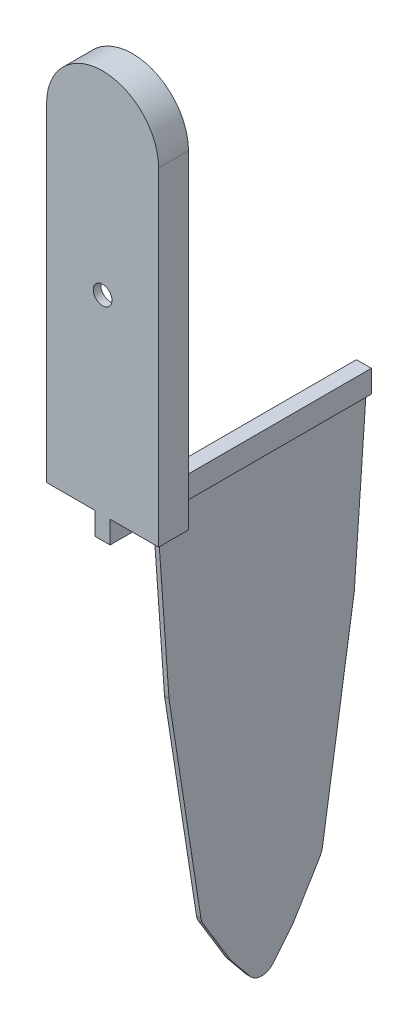
from build123d import *

# Parameters (mm, degrees)
EXTRUDE_1_DEPTH      = 4
CUT_EXTRUDE_1_DEPTH  = 3
SKETCH_5_R           = 1.25
CUT_EXTRUDE_2_DEPTH  = 12.4
EXTRUDE_2_DEPTH      = 1
EXTRUDE_2_DEPTH_BACK = 1
SKETCH_6_W           = 35
SKETCH_6_H           = 3
EXTRUDE_4_DEPTH      = 0.3


with BuildPart() as part:
    # 草圖1 → 填料-伸長1 (new body)
    with BuildSketch(Plane.XY):
        with BuildLine():
            Line((7.5, 8), (7.5, 52))
            ThreePointArc((7.5, 52), (0, 59.5), (-7.5, 52))
            Line((-7.5, 52), (-7.5, 8))
            Line((-7.5, 8), (7.5, 8))
        make_face()
    extrude(amount=EXTRUDE_1_DEPTH)

    # 草圖3 → 除料-伸長1 (cut)
    with BuildSketch(Plane.XY):
        with BuildLine():
            Line((4.745157216, 31.924092961), (5, 33.5))
            Line((5, 33.5), (4.738581133, 35.095571636))
            Line((4.738581133, 35.095571636), (2.296635758, 50))
            ThreePointArc((2.296635758, 50), (0, 52.296635758), (-2.296635758, 50))
            Line((-2.296635758, 50), (-4.738581133, 35.095571636))
            Line((-4.738581133, 35.095571636), (-5, 33.5))
            Line((-5, 33.5), (-4.739562708, 31.907346446))
            Line((-4.739562708, 31.907346446), (-2.301851795, 17))
            ThreePointArc((-2.301851795, 17), (-0.184323371, 14.705540024), (2.272331993, 16.632537074))
            Line((2.272331993, 16.632537074), (4.745157216, 31.924092961))
        make_face()
    extrude(amount=CUT_EXTRUDE_1_DEPTH, mode=Mode.SUBTRACT)

    # 草圖5 → 除料-伸長2 (cut)
    with BuildSketch(Plane.XY):
        with Locations((0, 33.5)):
            Circle(SKETCH_5_R)
    extrude(amount=CUT_EXTRUDE_2_DEPTH, mode=Mode.SUBTRACT)

    # 草圖6 → 填料-伸長2 (add, two sides: drawn at the far end of the back side and taken through both)
    with BuildSketch(Plane(origin=(0, 0, 0), x_dir=(0, 0, -1), z_dir=(1, 0, 0)).offset(-EXTRUDE_2_DEPTH_BACK)):
        with Locations((13.5, 6.5)):
            Rectangle(SKETCH_6_W, SKETCH_6_H)
    extrude(amount=EXTRUDE_2_DEPTH + EXTRUDE_2_DEPTH_BACK)

    # 草圖8 → 填料-伸長4 (add, symmetric)
    with BuildSketch(Plane(origin=(0, 0, 0), x_dir=(0, 0, -1), z_dir=(1, 0, 0))):
        with BuildLine():
            Line((31, 5), (29.412884636, -17.392266292))
            ThreePointArc((29.412884636, -17.392266292), (29.405303504, -17.474886329), (29.394302258, -17.557120851))
            Line((29.394302258, -17.557120851), (25.126031789, -45.102305987))
            Line((25.126031789, -45.102305987), (24.858838061, -45.834592809))
            Line((24.858838061, -45.834592809), (21.249328626, -51.775075213))
            ThreePointArc((21.249328626, -51.775075213), (21.172688517, -51.891818969), (21.088088438, -52.002929893))
            Line((21.088088438, -52.002929893), (18.547978888, -55.107829822))
            ThreePointArc((18.547978888, -55.107829822), (17, -55.841432822), (15.452021112, -55.107829822))
            Line((15.452021112, -55.107829822), (12.911911562, -52.002929893))
            ThreePointArc((12.911911562, -52.002929893), (12.827311483, -51.891818969), (12.750671374, -51.775075213))
            Line((12.750671374, -51.775075213), (9.141161939, -45.834592809))
            ThreePointArc((9.141161939, -45.834592809), (8.971543186, -45.481592913), (8.873968211, -45.102305987))
            Line((8.873968211, -45.102305987), (4.605697742, -17.557120851))
            ThreePointArc((4.605697742, -17.557120851), (4.594696496, -17.474886329), (4.587115364, -17.392266292))
            Line((4.587115364, -17.392266292), (3, 5))
            Line((3, 5), (31, 5))
        make_face()
    extrude(amount=EXTRUDE_4_DEPTH, both=True)


solid = part.part
